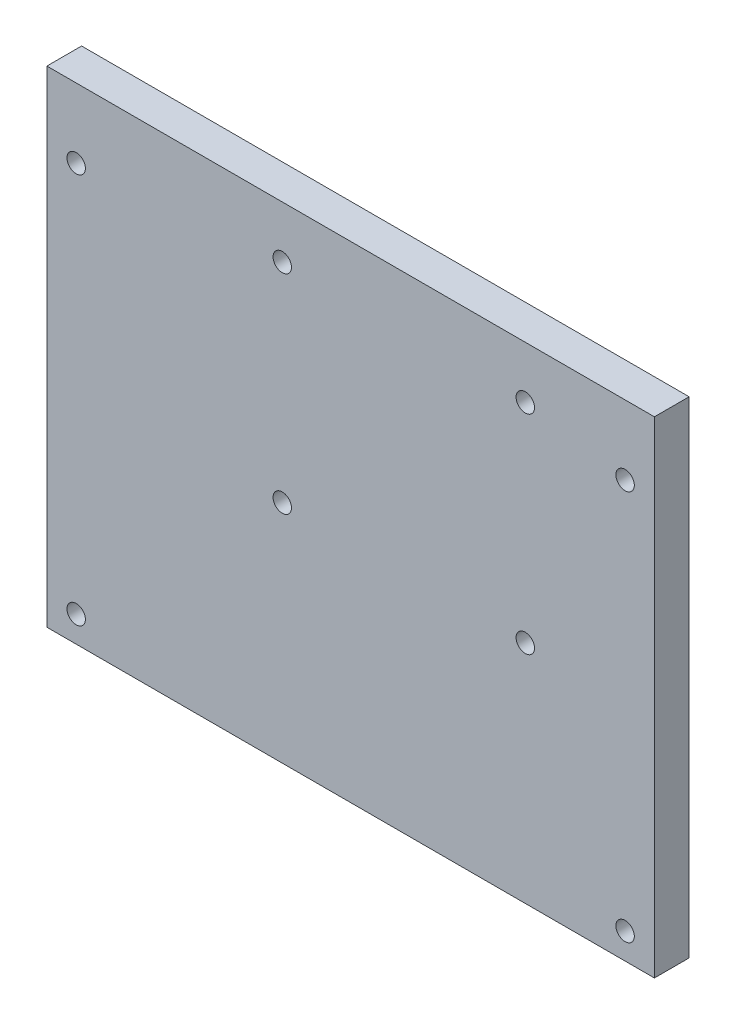
from build123d import *

# Parameters (mm, degrees)
SKETCH1_W           = 444.5
SKETCH1_H           = 355.6
BOSS_EXTRUDE1_DEPTH = 25.4
SKETCH2_R           = 6.7437
CUT_EXTRUDE1_DEPTH  = 570.804150564
SKETCH3_R           = 6.7437
CUT_EXTRUDE2_DEPTH  = 570.804150564
SKETCH4_R           = 11.1125
CUT_EXTRUDE3_DEPTH  = 9.525


with BuildPart() as part:
    # Sketch1 → Boss-Extrude1 (new body)
    with BuildSketch(Plane.XY):
        with Locations((222.25, 177.8)):
            Rectangle(SKETCH1_W, SKETCH1_H)
    extrude(amount=BOSS_EXTRUDE1_DEPTH)

    # Sketch2 → Cut-Extrude1 (cut, through all)
    with BuildSketch(Plane.XY):
        with Locations((172.2374, 165.1)):
            Circle(SKETCH2_R)
        with Locations((350.0374, 165.1)):
            Circle(SKETCH2_R)
        with Locations((172.2374, 317.5)):
            Circle(SKETCH2_R)
        with Locations((350.0374, 317.5)):
            Circle(SKETCH2_R)
    extrude(amount=CUT_EXTRUDE1_DEPTH, mode=Mode.SUBTRACT)

    # Sketch3 → Cut-Extrude2 (cut, through all)
    with BuildSketch(Plane.XY):
        with Locations((21.4376, 19.05)):
            Circle(SKETCH3_R)
        with Locations((423.0624, 19.05)):
            Circle(SKETCH3_R)
        with Locations((21.4376, 304.8)):
            Circle(SKETCH3_R)
        with Locations((423.0624, 304.8)):
            Circle(SKETCH3_R)
    extrude(amount=CUT_EXTRUDE2_DEPTH, mode=Mode.SUBTRACT)

    # Sketch4 → Cut-Extrude3 (cut)
    with BuildSketch(Plane.XY):
        with Locations((21.4376, 19.05)):
            Circle(SKETCH4_R)
        with Locations((423.0624, 19.05)):
            Circle(SKETCH4_R)
        with Locations((21.4376, 304.8)):
            Circle(SKETCH4_R)
        with Locations((423.0624, 304.8)):
            Circle(SKETCH4_R)
    extrude(amount=CUT_EXTRUDE3_DEPTH, mode=Mode.SUBTRACT)


solid = part.part
